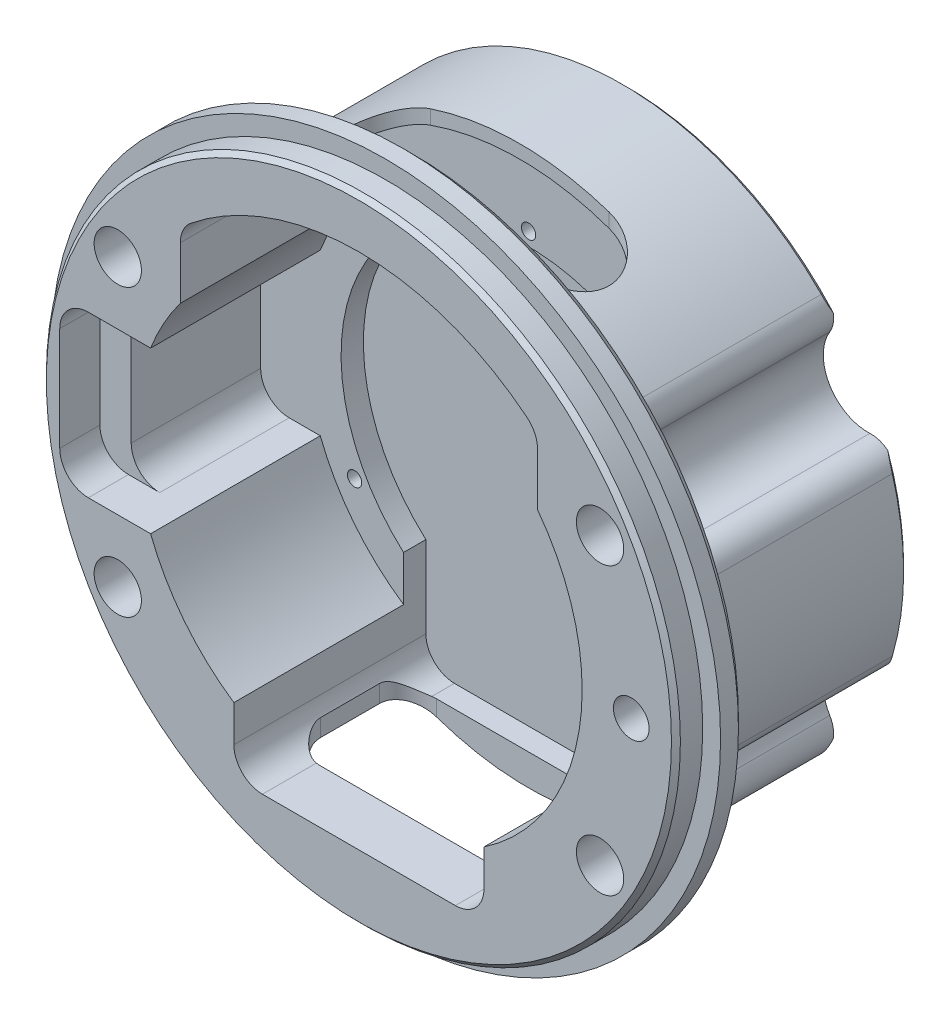
from build123d import *

# Parameters (mm, degrees)
SKETCH1_R                      = 37.5
BOSS_EXTRUDE1_DEPTH            = 27
SKETCH2_R                      = 35.5
BOSS_EXTRUDE2_DEPTH            = 3
SKETCH13_OUTSIDE_W             = 99.046
SKETCH13_OUTSIDE_H             = 99.046
SKETCH13_OUTSIDE_R             = 31.5
CUT_EXTRUDE2_DEPTH             = 24
CBORE_FOR_M5_SHCS1_D           = 5.3
CBORE_FOR_M5_SHCS1_CBORE_D     = 10
CBORE_FOR_M5_SHCS1_CBORE_DEPTH = 24
F_4_0MM_DOWEL_HOLE1_D          = 4
F_4_0MM_DOWEL_HOLE1_DEPTH      = 5
F_4_0MM_DOWEL_HOLE1_TIP        = 1.201721238
SKETCH8_R                      = 15.75
CUT_EXTRUDE1_DEPTH             = 6.5
M6X1_0_TAPPED_HOLE1_D          = 5
M6X1_0_TAPPED_HOLE1_DEPTH      = 8
M6X1_0_TAPPED_HOLE1_TIP        = 1.502151548
F_6_0MM_DOWEL_HOLE1_D          = 6
F_6_0MM_DOWEL_HOLE1_DEPTH      = 8
F_6_0MM_DOWEL_HOLE1_TIP        = 1.802581857
CHAMFER1_SIZE                  = 0.5
FILLET1_R                      = 3
CHAMFER2_SIZE                  = 0.5
CHAMFER3_SIZE                  = 1
CHAMFER4_SIZE                  = 0.5
SKETCH25_R                     = 21
CUT_EXTRUDE11_DEPTH            = 21.5
CUT_EXTRUDE12_DEPTH            = 21.5
CUT_EXTRUDE14_DEPTH            = 4.5
SKETCH29_R                     = 25
CUT_EXTRUDE15_DEPTH            = 19
CUT_EXTRUDE16_DEPTH            = 14.5
M2X0_4_TAPPED_HOLE2_D          = 1.6
M2X0_4_TAPPED_HOLE2_DEPTH      = 5.2
M2X0_4_TAPPED_HOLE2_TIP        = 0.480688495
CUT_EXTRUDE17_REACH            = 86.067
CUT_EXTRUDE17_END_RADIUS       = 25
CUT_EXTRUDE18_REACH            = 86.067
CUT_EXTRUDE19_REACH            = 62.93


with BuildPart() as part:
    # Sketch1 → Boss-Extrude1 (new body)
    with BuildSketch(Plane.XY):
        Circle(SKETCH1_R)
    extrude(amount=BOSS_EXTRUDE1_DEPTH)

    # Sketch2 → Boss-Extrude2 (add)
    with BuildSketch(Plane.XY.offset(27)):
        Circle(SKETCH2_R)
    extrude(amount=BOSS_EXTRUDE2_DEPTH)

    # Sketch13 outside → Cut-Extrude2 (cut)
    with BuildSketch(Plane(origin=(0, 0, 0), x_dir=(-1, 0, 0), z_dir=(0, 0, -1))):
        Rectangle(SKETCH13_OUTSIDE_W, SKETCH13_OUTSIDE_H)
        Circle(SKETCH13_OUTSIDE_R, mode=Mode.SUBTRACT)
    extrude(amount=-CUT_EXTRUDE2_DEPTH, mode=Mode.SUBTRACT)

    # CBORE for M5 SHCS1 (through all)
    with Locations(Plane(origin=(0, 0, 0), x_dir=(-1, 0, 0), z_dir=(0, 0, -1))):
        with Locations((-27, -16), (-27, 16), (27, 16), (27, -16)):
            CounterBoreHole(CBORE_FOR_M5_SHCS1_D / 2, CBORE_FOR_M5_SHCS1_CBORE_D / 2, CBORE_FOR_M5_SHCS1_CBORE_DEPTH)

    # Ø4.0mm Dowel Hole1
    with Locations(Plane(origin=(0, 0, 30), x_dir=(-1, 0, 0), z_dir=(0, 0, 1))):
        with Locations((-30.5, 0)):
            Hole(F_4_0MM_DOWEL_HOLE1_D / 2, depth=F_4_0MM_DOWEL_HOLE1_DEPTH)
            with Locations((0, 0, -(F_4_0MM_DOWEL_HOLE1_DEPTH + F_4_0MM_DOWEL_HOLE1_TIP / 2))):  # 118° drill point
                Cone(0, F_4_0MM_DOWEL_HOLE1_D / 2, F_4_0MM_DOWEL_HOLE1_TIP, mode=Mode.SUBTRACT)

    # Sketch8 → Cut-Extrude1 (cut)
    with BuildSketch(Plane(origin=(0, 0, 0), x_dir=(-1, 0, 0), z_dir=(0, 0, -1))):
        Circle(SKETCH8_R)
    extrude(amount=-CUT_EXTRUDE1_DEPTH, mode=Mode.SUBTRACT)

    # M6x1.0 Tapped Hole1
    with Locations(Plane(origin=(0, 0, 0), x_dir=(-1, 0, 0), z_dir=(0, 0, -1))):
        with Locations((-17.67766953, -17.67766953), (-17.67766953, 17.67766953), (17.67766953, 17.67766953), (17.67766953, -17.67766953)):
            Hole(M6X1_0_TAPPED_HOLE1_D / 2, depth=M6X1_0_TAPPED_HOLE1_DEPTH)
            with Locations((0, 0, -(M6X1_0_TAPPED_HOLE1_DEPTH + M6X1_0_TAPPED_HOLE1_TIP / 2))):  # 118° drill point
                Cone(0, M6X1_0_TAPPED_HOLE1_D / 2, M6X1_0_TAPPED_HOLE1_TIP, mode=Mode.SUBTRACT)

    # Ø6.0mm Dowel Hole1
    with Locations(Plane(origin=(0, 0, 0), x_dir=(-1, 0, 0), z_dir=(0, 0, -1))):
        with Locations((-25, 0)):
            Hole(F_6_0MM_DOWEL_HOLE1_D / 2, depth=F_6_0MM_DOWEL_HOLE1_DEPTH)
            with Locations((0, 0, -(F_6_0MM_DOWEL_HOLE1_DEPTH + F_6_0MM_DOWEL_HOLE1_TIP / 2))):  # 118° drill point
                Cone(0, F_6_0MM_DOWEL_HOLE1_D / 2, F_6_0MM_DOWEL_HOLE1_TIP, mode=Mode.SUBTRACT)

    # Chamfer1
    chamfer1_edges = [part.edges().sort_by_distance(p)[0] for p in [
        (-35.5, 0, 30),
    ]]
    chamfer(chamfer1_edges, length=CHAMFER1_SIZE)

    # Fillet1
    fillet1_edges = [part.edges().sort_by_distance(p)[0] for p in [
        (29.301657935, -11.561264735, 12),
        (24.211793842, -20.150410392, 12),
        (-29.301657935, -11.561264735, 12),
        (-24.211793842, -20.150410392, 12),
        (-24.211793842, 20.150410392, 12),
        (-29.301657935, 11.561264735, 12),
        (29.301657935, 11.561264735, 12),
        (24.211793842, 20.150410392, 12),
    ]]
    fillet(fillet1_edges, radius=FILLET1_R)

    # Chamfer2
    # the kernel refuses this chamfer: 0.5 mm, written as the material it takes off along each edge
    with BuildSketch(Plane(origin=(0, 0, 0), x_dir=(-0.9379219911039276, 0.3468462751762571, 0), z_dir=(0.3468462751762571, 0.9379219911039276, 0))) as chamfer2_piece_1:
        Polygon((31.5, CHAMFER2_SIZE), (31.5 - CHAMFER2_SIZE, 0), (31.5, 0), align=None)
    revolve(axis=Axis((0, 0, 0), (0, 0, 1)), revolution_arc=40.589080157, mode=Mode.SUBTRACT)
    with BuildSketch(Plane(origin=(0, 0, 0), x_dir=(0.9379219911039277, 0.34684627517625694, 0), z_dir=(-0.34684627517625694, 0.9379219911039277, 0))) as chamfer2_piece_2:
        Polygon((31.5, -CHAMFER2_SIZE), (31.5 - CHAMFER2_SIZE, 0), (31.5, 0), align=None)
    revolve(axis=Axis((0, 0, 0), (0, 0, -1)), revolution_arc=40.589080157, mode=Mode.SUBTRACT)
    with BuildSketch(Plane(origin=(0, 0, 0), x_dir=(0.7546476598938566, -0.6561302533923628, 0), z_dir=(0.6561302533923628, 0.7546476598938566, 0))) as chamfer2_piece_3:
        Polygon((31.5, -CHAMFER2_SIZE), (31.5 - CHAMFER2_SIZE, 0), (31.5, 0), align=None)
    revolve(axis=Axis((0, 0, 0), (0, 0, -1)), revolution_arc=97.989185178, mode=Mode.SUBTRACT)
    with BuildSketch(Plane(origin=(0, 0, 0), x_dir=(-0.7546476598938564, 0.6561302533923628, 0), z_dir=(-0.6561302533923628, -0.7546476598938564, 0))) as chamfer2_piece_4:
        Polygon((31.5, -CHAMFER2_SIZE), (31.5 - CHAMFER2_SIZE, 0), (31.5, 0), align=None)
    revolve(axis=Axis((0, 0, 0), (0, 0, -1)), revolution_arc=97.989185178, mode=Mode.SUBTRACT)

    # Chamfer3
    chamfer3_edges = [part.edges().sort_by_distance(p)[0] for p in [
        (-37.5, 0, 24),
    ]]
    chamfer(chamfer3_edges, length=CHAMFER3_SIZE)

    # Chamfer4
    chamfer4_edges = [part.edges().sort_by_distance(p)[0] for p in [
        (15.75, 0, 0),
    ]]
    chamfer(chamfer4_edges, length=CHAMFER4_SIZE)

    # Sketch25 → Cut-Extrude11 (cut)
    with BuildSketch(Plane.XY.offset(30)):
        Circle(SKETCH25_R)
    extrude(amount=-CUT_EXTRUDE11_DEPTH, mode=Mode.SUBTRACT)

    # Sketch26 → Cut-Extrude12 (cut)
    with BuildSketch(Plane.XY.offset(30)):
        with BuildLine():
            Line((-10.8, 0), (10.8, 0))
            ThreePointArc((10.8, 0), (13.0627417, -0.9372583), (14, -3.2))
            Line((14, -3.2), (14, -24.8))
            ThreePointArc((14, -24.8), (13.0627417, -27.0627417), (10.8, -28))
            Line((10.8, -28), (-10.8, -28))
            ThreePointArc((-10.8, -28), (-13.0627417, -27.0627417), (-14, -24.8))
            Line((-14, -24.8), (-14, -3.2))
            ThreePointArc((-14, -3.2), (-13.0627417, -0.9372583), (-10.8, 0))
        make_face()
    extrude(amount=-CUT_EXTRUDE12_DEPTH, mode=Mode.SUBTRACT)

    # Sketch28 → Cut-Extrude14 (cut)
    with BuildSketch(Plane.XY.offset(30)):
        with BuildLine():
            Line((-6.30013975, 9), (-30.3, 9))
            ThreePointArc((-30.3, 9), (-32.5627417, 8.0627417), (-33.5, 5.8))
            Line((-33.5, 5.8), (-33.5, -5.8))
            ThreePointArc((-33.5, -5.8), (-32.5627417, -8.0627417), (-30.3, -9))
            Line((-30.3, -9), (-6.30013975, -9))
            ThreePointArc((-6.30013975, -9), (-4.037398051, -8.0627417), (-3.10013975, -5.8))
            Line((-3.10013975, -5.8), (-3.10013975, 5.8))
            ThreePointArc((-3.10013975, 5.8), (-4.037398051, 8.0627417), (-6.30013975, 9))
        make_face()
    extrude(amount=-CUT_EXTRUDE14_DEPTH, mode=Mode.SUBTRACT)

    # Sketch29 → Cut-Extrude15 (cut)
    with BuildSketch(Plane.XY.offset(30)):
        Circle(SKETCH29_R)
    extrude(amount=-CUT_EXTRUDE15_DEPTH, mode=Mode.SUBTRACT)

    # Sketch30 → Cut-Extrude16 (cut)
    with BuildSketch(Plane.XY.offset(25.5)):
        with BuildLine():
            Line((-26.8, -9), (-23.323807579, -9))
            ThreePointArc((-23.323807579, -9), (-25, 0), (-23.323807579, 9))
            Line((-23.323807579, 9), (-26.8, 9))
            ThreePointArc((-26.8, 9), (-29.0627417, 8.0627417), (-30, 5.8))
            Line((-30, 5.8), (-30, -5.8))
            ThreePointArc((-30, -5.8), (-29.0627417, -8.0627417), (-26.8, -9))
        make_face()
    extrude(amount=-CUT_EXTRUDE16_DEPTH, mode=Mode.SUBTRACT)

    # M2x0.4 Tapped Hole2
    with Locations(Plane.XY.offset(11)):
        with Locations((-19.485571585, -11.25), (0, 22.5), (19.485571585, -11.25)):
            Hole(M2X0_4_TAPPED_HOLE2_D / 2, depth=M2X0_4_TAPPED_HOLE2_DEPTH)
            with Locations((0, 0, -(M2X0_4_TAPPED_HOLE2_DEPTH + M2X0_4_TAPPED_HOLE2_TIP / 2))):  # 118° drill point
                Cone(0, M2X0_4_TAPPED_HOLE2_D / 2, M2X0_4_TAPPED_HOLE2_TIP, mode=Mode.SUBTRACT)

    # Cut-Extrude17: up to this cylinder (the profile starts outside it)
    cut_extrude17_end = Plane(origin=(0, 0, 17), z_dir=(0, 0, 1)) * Cylinder(CUT_EXTRUDE17_END_RADIUS, 223.134, mode=Mode.PRIVATE)
    # Sketch34 → Cut-Extrude17 (cut, up to the surface)
    with BuildSketch(Plane(origin=(0, 31.5, 0), x_dir=(1, 0, 0), z_dir=(0, 1, 0)), mode=Mode.PRIVATE) as cut_extrude17_sk1:
        with BuildLine():
            Line((10, -22), (-10, -22))
            ThreePointArc((-10, -22), (-15, -17), (-10, -12))
            Line((-10, -12), (10, -12))
            ThreePointArc((10, -12), (15, -17), (10, -22))
        make_face()
    cut_extrude17_tool1 = extrude(cut_extrude17_sk1.sketch, amount=-CUT_EXTRUDE17_REACH, mode=Mode.PRIVATE) - cut_extrude17_end
    add(cut_extrude17_tool1.solids().sort_by_distance((0, 31.5, 17))[0], mode=Mode.SUBTRACT)

    # Sketch35 → Cut-Extrude18 (cut, up to next)
    with BuildSketch(Plane(origin=(0, -31.5, 0), x_dir=(-1, 0, 0), z_dir=(0, -1, 0)), mode=Mode.PRIVATE) as cut_extrude18_sk1:
        with BuildLine():
            Line((-10.3, -11), (10.3, -11))
            ThreePointArc((10.3, -11), (12.5627417, -11.9372583), (13.5, -14.2))
            Line((13.5, -14.2), (13.5, -20.8))
            ThreePointArc((13.5, -20.8), (12.5627417, -23.0627417), (10.3, -24))
            Line((10.3, -24), (-10.3, -24))
            ThreePointArc((-10.3, -24), (-12.5627417, -23.0627417), (-13.5, -20.8))
            Line((-13.5, -20.8), (-13.5, -14.2))
            ThreePointArc((-13.5, -14.2), (-12.5627417, -11.9372583), (-10.3, -11))
        make_face()
    cut_extrude18_tool1 = extrude(cut_extrude18_sk1.sketch, amount=-CUT_EXTRUDE18_REACH, mode=Mode.PRIVATE) & part.part
    add(cut_extrude18_tool1.solids().sort_by_distance((0, -31.5, 17.5))[0], mode=Mode.SUBTRACT)

    # Cut-Extrude19: up to this face of the body (flat: up to its plane)
    cut_extrude19_end = Plane(part.part.faces().sort_by_distance((14.715165419, -18.18239551, 11))[0])
    # Sketch36 → Cut-Extrude19 (cut, up to the picked face)
    with BuildSketch(Plane.XY.offset(30), mode=Mode.PRIVATE) as cut_extrude19_sk1:
        with BuildLine():
            Line((20, 15), (20, 20.880613018))
            ThreePointArc((20, 20.880613018), (19.686096367, 22.262802499), (18.805970149, 23.373820542))
            ThreePointArc((18.805970149, 23.373820542), (0, 30), (-18.805970149, 23.373820542))
            ThreePointArc((-18.805970149, 23.373820542), (-19.686096367, 22.262802499), (-20, 20.880613018))
            Line((-20, 20.880613018), (-20, 15))
            ThreePointArc((-20, 15), (0, 25), (20, 15))
        make_face()
    cut_extrude19_tool1 = split(extrude(cut_extrude19_sk1.sketch, amount=-CUT_EXTRUDE19_REACH, mode=Mode.PRIVATE), bisect_by=cut_extrude19_end, keep=Keep.BOTH, mode=Mode.PRIVATE)
    add(cut_extrude19_tool1.solids().sort_by(Axis((19.5728, 17.940307, 30), (0, 0, -1)))[0], mode=Mode.SUBTRACT)


solid = part.part
